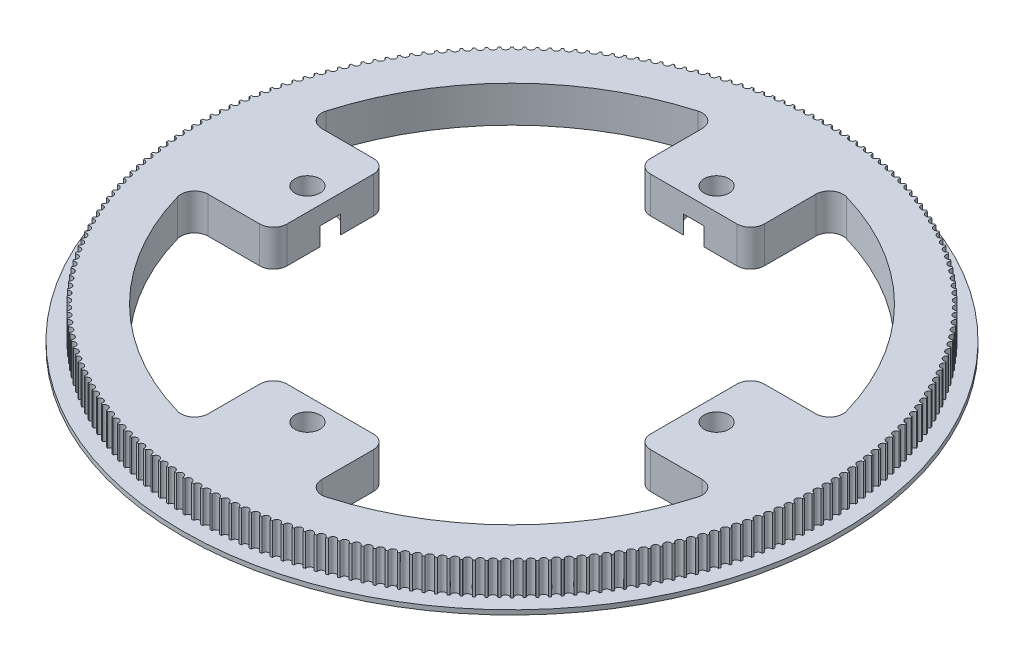
from build123d import *

# Parameters (mm, degrees)
BOSS_EXTRUDE1_DEPTH = 7
SKETCH3_R           = 72.5
BOSS_EXTRUDE3_DEPTH = 1
SKETCH13_R          = 2.75
CUT_EXTRUDE8_DEPTH  = 103.842111997
SKETCH14_R          = 40
CUT_EXTRUDE9_DEPTH  = 103.842111997
FILLET3_R           = 3
SKETCH15_R          = 5.5
CUT_EXTRUDE10_DEPTH = 4


with BuildPart() as part:
    # Sketch1 → Boss-Extrude1 (new body)
    with BuildSketch(Plane(origin=(0, 0, 0), x_dir=(1, 0, 0), z_dir=(0, 1, 0))):
        with BuildLine():
            ThreePointArc((-0.759988559, 69.250829904), (-0.988925477, 69.247938969), (-1.217851586, 69.244291191))
            ThreePointArc((-1.217851586, 69.244291191), (-1.955946699, 68.467067248), (-2.737208847, 69.200886647))
            ThreePointArc((-2.737208847, 69.200886647), (-2.965969848, 69.191459356), (-3.194698434, 69.18127584))
            ThreePointArc((-3.194698434, 69.18127584), (-3.9102981, 68.383291773), (-4.712196627, 69.094502154))
            ThreePointArc((-4.712196627, 69.094502154), (-4.940595132, 69.078546197), (-5.168939639, 69.061835249))
            ThreePointArc((-5.168939639, 69.061835249), (-5.861460206, 68.243741905), (-6.683341073, 68.931763195))
            ThreePointArc((-6.683341073, 68.931763195), (-6.911190796, 68.909291585), (-7.138964984, 68.886066835))
            ThreePointArc((-7.138964984, 68.886066835), (-7.80784162, 68.048531463), (-8.64903449, 68.7128025))
            ThreePointArc((-8.64903449, 68.7128025), (-8.876149594, 68.683833566), (-9.103167686, 68.654113956))
            ThreePointArc((-9.103167686, 68.654113956), (-9.747854848, 67.797819662), (-10.60767363, 68.437798658))
            ThreePointArc((-10.60767363, 68.437798658), (-10.833868876, 68.402356028), (-11.059945715, 68.366165797))
            ThreePointArc((-11.059945715, 68.366165797), (-11.679917584, 67.491810986), (-12.557660999, 68.106975966))
            ThreePointArc((-12.557660999, 68.106975966), (-12.7827519, 68.065088547), (-13.007703093, 68.022457213))
            ThreePointArc((-13.007703093, 68.022457213), (-13.602454013, 67.130755022), (-14.49740616, 67.720604247))
            ThreePointArc((-14.49740616, 67.720604247), (-14.721209128, 67.672306203), (-14.944851201, 67.623268537))
            ThreePointArc((-14.944851201, 67.623268537), (-15.513896085, 66.714946251), (-16.425327028, 67.278998633))
            ThreePointArc((-16.425327028, 67.278998633), (-16.647659527, 67.224329355), (-16.869810075, 67.168925353))
            ThreePointArc((-16.869810075, 67.168925353), (-17.412684801, 66.244723813), (-18.339851164, 66.782519302))
            ThreePointArc((-18.339851164, 66.782519302), (-18.560531855, 66.721523381), (-18.78100969, 66.65979823))
            ThreePointArc((-18.78100969, 66.65979823), (-19.297271481, 65.720471228), (-20.239417055, 66.23157119))
            ThreePointArc((-20.239417055, 66.23157119), (-20.458265948, 66.164298375), (-20.676891243, 66.096302419))
            ThreePointArc((-20.676891243, 66.096302419), (-21.16611903, 65.142616084), (-22.122475387, 65.626603659))
            ThreePointArc((-22.122475387, 65.626603659), (-22.339313986, 65.553108818), (-22.555908428, 65.478897517))
            ThreePointArc((-22.555908428, 65.478897517), (-23.017703188, 64.511629687), (-23.98749031, 64.968110128))
            ThreePointArc((-23.98749031, 64.968110128), (-24.202141758, 64.888453205), (-24.41652869, 64.808087086))
            ThreePointArc((-24.41652869, 64.808087086), (-24.850513778, 63.828026681), (-25.832940692, 64.256627675))
            ThreePointArc((-25.832940692, 64.256627675), (-26.045229917, 64.170873639), (-26.257234481, 64.08441825))
            ThreePointArc((-26.257234481, 64.08441825), (-26.663055932, 63.09236462), (-27.657321357, 63.492736595))
            ThreePointArc((-27.657321357, 63.492736595), (-27.867075212, 63.400955388), (-28.076524495, 63.308481243))
            ThreePointArc((-28.076524495, 63.308481243), (-28.453851316, 62.305243522), (-29.459144315, 62.677059928))
            ThreePointArc((-29.459144315, 62.677059928), (-29.666191722, 62.579326408), (-29.872914893, 62.48090893))
            ThreePointArc((-29.872914893, 62.48090893), (-30.22143933, 61.467305373), (-31.236939971, 61.810262952))
            ThreePointArc((-31.236939971, 61.810262952), (-31.441112059, 61.706656833), (-31.644940513, 61.602376293))
            ThreePointArc((-31.644940513, 61.602376293), (-31.964378304, 60.579233609), (-32.989258331, 60.893052639))
            ThreePointArc((-32.989258331, 60.893052639), (-33.190388575, 60.783658422), (-33.391156066, 60.673599873))
            ThreePointArc((-33.391156066, 60.673599873), (-33.681246674, 59.641752552), (-34.71467018, 59.926177079))
            ThreePointArc((-34.71467018, 59.926177079), (-34.912594534, 59.811083989), (-35.110137313, 59.695337195))
            ThreePointArc((-35.110137313, 59.695337195), (-35.370644135, 58.655626827), (-36.411768245, 58.910424869))
            ThreePointArc((-36.411768245, 58.910424869), (-36.60632528, 58.789726777), (-36.800482228, 58.668386144))
            ThreePointArc((-36.800482228, 58.668386144), (-37.031192792, 57.621660731), (-38.079168349, 57.846624472))
            ThreePointArc((-38.079168349, 57.846624472), (-38.270199382, 57.72041982), (-38.460812142, 57.593584316))
            ThreePointArc((-38.460812142, 57.593584316), (-38.661538276, 56.540697582), (-39.715510538, 56.735643538))
            ThreePointArc((-39.715510538, 56.735643538), (-39.902859761, 56.604035262), (-40.089772867, 56.471808334))
            ThreePointArc((-40.089772867, 56.471808334), (-40.260350856, 55.41361903), (-41.319460187, 55.5783882))
            ThreePointArc((-41.319460187, 55.5783882), (-41.502974794, 55.44148364), (-41.686035797, 55.303973135))
            ThreePointArc((-41.686035797, 55.303973135), (-41.826326516, 54.241344334), (-42.889709091, 54.375802331))
            ThreePointArc((-42.889709091, 54.375802331), (-43.069239406, 54.233713149), (-43.248298998, 54.091031223))
            ThreePointArc((-43.248298998, 54.091031223), (-43.358188024, 53.024829621), (-44.424976533, 53.128866777))
            ThreePointArc((-44.424976533, 53.128866777), (-44.600376129, 52.981708864), (-44.775288267, 52.833971889))
            ThreePointArc((-44.775288267, 52.833971889), (-44.854685972, 51.765067095), (-45.924010327, 51.838598558))
            ThreePointArc((-45.924010327, 51.838598558), (-46.095136145, 51.686491937), (-46.265758168, 51.533820411))
            ThreePointArc((-46.265758168, 51.533820411), (-46.314599794, 50.463084239), (-47.38558784, 50.506050034))
            ThreePointArc((-47.38558784, 50.506050034), (-47.552300307, 50.349118766), (-47.718493053, 50.191637209))
            ThreePointArc((-47.718493053, 50.191637209), (-47.736738765, 49.119942967), (-48.808516988, 49.132308051))
            ThreePointArc((-48.808516988, 49.132308051), (-48.970680131, 48.970680131), (-49.132308051, 48.808516988))
            ThreePointArc((-49.132308051, 48.808516988), (-49.119942967, 47.736738765), (-50.191637209, 47.718493053))
            ThreePointArc((-50.191637209, 47.718493053), (-50.349118766, 47.552300307), (-50.506050034, 47.38558784))
            ThreePointArc((-50.506050034, 47.38558784), (-50.463084239, 46.314599794), (-51.533820411, 46.265758168))
            ThreePointArc((-51.533820411, 46.265758168), (-51.686491937, 46.095136145), (-51.838598558, 45.924010327))
            ThreePointArc((-51.838598558, 45.924010327), (-51.765067095, 44.854685972), (-52.833971889, 44.775288267))
            ThreePointArc((-52.833971889, 44.775288267), (-52.981708864, 44.600376129), (-53.128866777, 44.424976533))
            ThreePointArc((-53.128866777, 44.424976533), (-53.024829621, 43.358188024), (-54.091031223, 43.248298998))
            ThreePointArc((-54.091031223, 43.248298998), (-54.233713149, 43.069239406), (-54.375802331, 42.889709091))
            ThreePointArc((-54.375802331, 42.889709091), (-54.241344334, 41.826326516), (-55.303973135, 41.686035797))
            ThreePointArc((-55.303973135, 41.686035797), (-55.44148364, 41.502974794), (-55.5783882, 41.319460187))
            ThreePointArc((-55.5783882, 41.319460187), (-55.41361903, 40.260350856), (-56.471808334, 40.089772867))
            ThreePointArc((-56.471808334, 40.089772867), (-56.604035262, 39.902859761), (-56.735643538, 39.715510538))
            ThreePointArc((-56.735643538, 39.715510538), (-56.540697582, 38.661538276), (-57.593584316, 38.460812142))
            ThreePointArc((-57.593584316, 38.460812142), (-57.72041982, 38.270199382), (-57.846624472, 38.079168349))
            ThreePointArc((-57.846624472, 38.079168349), (-57.621660731, 37.031192792), (-58.668386144, 36.800482228))
            ThreePointArc((-58.668386144, 36.800482228), (-58.789726777, 36.60632528), (-58.910424869, 36.411768245))
            ThreePointArc((-58.910424869, 36.411768245), (-58.655626827, 35.370644135), (-59.695337195, 35.110137313))
            ThreePointArc((-59.695337195, 35.110137313), (-59.811083989, 34.912594534), (-59.926177079, 34.71467018))
            ThreePointArc((-59.926177079, 34.71467018), (-59.641752552, 33.681246674), (-60.673599873, 33.391156066))
            ThreePointArc((-60.673599873, 33.391156066), (-60.783658422, 33.190388575), (-60.893052639, 32.989258331))
            ThreePointArc((-60.893052639, 32.989258331), (-60.579233609, 31.964378304), (-61.602376293, 31.644940513))
            ThreePointArc((-61.602376293, 31.644940513), (-61.706656833, 31.441112059), (-61.810262952, 31.236939971))
            ThreePointArc((-61.810262952, 31.236939971), (-61.467305373, 30.22143933), (-62.48090893, 29.872914893))
            ThreePointArc((-62.48090893, 29.872914893), (-62.579326408, 29.666191722), (-62.677059928, 29.459144315))
            ThreePointArc((-62.677059928, 29.459144315), (-62.305243522, 28.453851316), (-63.308481243, 28.076524495))
            ThreePointArc((-63.308481243, 28.076524495), (-63.400955388, 27.867075212), (-63.492736595, 27.657321357))
            ThreePointArc((-63.492736595, 27.657321357), (-63.09236462, 26.663055932), (-64.08441825, 26.257234481))
            ThreePointArc((-64.08441825, 26.257234481), (-64.170873639, 26.045229917), (-64.256627675, 25.832940692))
            ThreePointArc((-64.256627675, 25.832940692), (-63.828026681, 24.850513778), (-64.808087086, 24.41652869))
            ThreePointArc((-64.808087086, 24.41652869), (-64.888453205, 24.202141758), (-64.968110128, 23.98749031))
            ThreePointArc((-64.968110128, 23.98749031), (-64.511629687, 23.017703188), (-65.478897517, 22.555908428))
            ThreePointArc((-65.478897517, 22.555908428), (-65.553108818, 22.339313986), (-65.626603659, 22.122475387))
            ThreePointArc((-65.626603659, 22.122475387), (-65.142616084, 21.16611903), (-66.096302419, 20.676891243))
            ThreePointArc((-66.096302419, 20.676891243), (-66.164298375, 20.458265948), (-66.23157119, 20.239417055))
            ThreePointArc((-66.23157119, 20.239417055), (-65.720471228, 19.297271481), (-66.65979823, 18.78100969))
            ThreePointArc((-66.65979823, 18.78100969), (-66.721523381, 18.560531855), (-66.782519302, 18.339851164))
            ThreePointArc((-66.782519302, 18.339851164), (-66.244723813, 17.412684801), (-67.168925353, 16.869810075))
            ThreePointArc((-67.168925353, 16.869810075), (-67.224329355, 16.647659527), (-67.278998633, 16.425327028))
            ThreePointArc((-67.278998633, 16.425327028), (-66.714946251, 15.513896085), (-67.623268537, 14.944851201))
            ThreePointArc((-67.623268537, 14.944851201), (-67.672306203, 14.721209128), (-67.720604247, 14.49740616))
            ThreePointArc((-67.720604247, 14.49740616), (-67.130755022, 13.602454013), (-68.022457213, 13.007703093))
            ThreePointArc((-68.022457213, 13.007703093), (-68.065088547, 12.7827519), (-68.106975966, 12.557660999))
            ThreePointArc((-68.106975966, 12.557660999), (-67.491810986, 11.679917584), (-68.366165797, 11.059945715))
            ThreePointArc((-68.366165797, 11.059945715), (-68.402356028, 10.833868876), (-68.437798658, 10.60767363))
            ThreePointArc((-68.437798658, 10.60767363), (-67.797819662, 9.747854848), (-68.654113956, 9.103167686))
            ThreePointArc((-68.654113956, 9.103167686), (-68.683833566, 8.876149594), (-68.7128025, 8.64903449))
            ThreePointArc((-68.7128025, 8.64903449), (-68.048531463, 7.80784162), (-68.886066835, 7.138964984))
            ThreePointArc((-68.886066835, 7.138964984), (-68.909291585, 6.911190796), (-68.931763195, 6.683341073))
            ThreePointArc((-68.931763195, 6.683341073), (-68.243741905, 5.861460206), (-69.061835249, 5.168939639))
            ThreePointArc((-69.061835249, 5.168939639), (-69.078546197, 4.940595132), (-69.094502154, 4.712196627))
            ThreePointArc((-69.094502154, 4.712196627), (-68.383291773, 3.9102981), (-69.18127584, 3.194698434))
            ThreePointArc((-69.18127584, 3.194698434), (-69.191459356, 2.965969848), (-69.200886647, 2.737208847))
            ThreePointArc((-69.200886647, 2.737208847), (-68.467067248, 1.955946699), (-69.244291191, 1.217851586))
            ThreePointArc((-69.244291191, 1.217851586), (-69.247938969, 0.988925477), (-69.250829904, 0.759988559))
            ThreePointArc((-69.250829904, 0.759988559), (-68.495, 0), (-69.250829904, -0.759988559))
            ThreePointArc((-69.250829904, -0.759988559), (-69.247938969, -0.988925477), (-69.244291191, -1.217851586))
            ThreePointArc((-69.244291191, -1.217851586), (-68.467067248, -1.955946699), (-69.200886647, -2.737208847))
            ThreePointArc((-69.200886647, -2.737208847), (-69.191459356, -2.965969848), (-69.18127584, -3.194698434))
            ThreePointArc((-69.18127584, -3.194698434), (-68.383291773, -3.9102981), (-69.094502154, -4.712196627))
            ThreePointArc((-69.094502154, -4.712196627), (-69.078546197, -4.940595132), (-69.061835249, -5.168939639))
            ThreePointArc((-69.061835249, -5.168939639), (-68.243741905, -5.861460206), (-68.931763195, -6.683341073))
            ThreePointArc((-68.931763195, -6.683341073), (-68.909291585, -6.911190796), (-68.886066835, -7.138964984))
            ThreePointArc((-68.886066835, -7.138964984), (-68.048531463, -7.80784162), (-68.7128025, -8.64903449))
            ThreePointArc((-68.7128025, -8.64903449), (-68.683833566, -8.876149594), (-68.654113956, -9.103167686))
            ThreePointArc((-68.654113956, -9.103167686), (-67.797819662, -9.747854848), (-68.437798658, -10.60767363))
            ThreePointArc((-68.437798658, -10.60767363), (-68.402356028, -10.833868876), (-68.366165797, -11.059945715))
            ThreePointArc((-68.366165797, -11.059945715), (-67.491810986, -11.679917584), (-68.106975966, -12.557660999))
            ThreePointArc((-68.106975966, -12.557660999), (-68.065088547, -12.7827519), (-68.022457213, -13.007703093))
            ThreePointArc((-68.022457213, -13.007703093), (-67.130755022, -13.602454013), (-67.720604247, -14.49740616))
            ThreePointArc((-67.720604247, -14.49740616), (-67.672306203, -14.721209128), (-67.623268537, -14.944851201))
            ThreePointArc((-67.623268537, -14.944851201), (-66.714946251, -15.513896085), (-67.278998633, -16.425327028))
            ThreePointArc((-67.278998633, -16.425327028), (-67.224329355, -16.647659527), (-67.168925353, -16.869810075))
            ThreePointArc((-67.168925353, -16.869810075), (-66.244723813, -17.412684801), (-66.782519302, -18.339851164))
            ThreePointArc((-66.782519302, -18.339851164), (-66.721523381, -18.560531855), (-66.65979823, -18.78100969))
            ThreePointArc((-66.65979823, -18.78100969), (-65.720471228, -19.297271481), (-66.23157119, -20.239417055))
            ThreePointArc((-66.23157119, -20.239417055), (-66.164298375, -20.458265948), (-66.096302419, -20.676891243))
            ThreePointArc((-66.096302419, -20.676891243), (-65.142616084, -21.16611903), (-65.626603659, -22.122475387))
            ThreePointArc((-65.626603659, -22.122475387), (-65.553108818, -22.339313986), (-65.478897517, -22.555908428))
            ThreePointArc((-65.478897517, -22.555908428), (-64.511629687, -23.017703188), (-64.968110128, -23.98749031))
            ThreePointArc((-64.968110128, -23.98749031), (-64.888453205, -24.202141758), (-64.808087086, -24.41652869))
            ThreePointArc((-64.808087086, -24.41652869), (-63.828026681, -24.850513778), (-64.256627675, -25.832940692))
            ThreePointArc((-64.256627675, -25.832940692), (-64.170873639, -26.045229917), (-64.08441825, -26.257234481))
            ThreePointArc((-64.08441825, -26.257234481), (-63.09236462, -26.663055932), (-63.492736595, -27.657321357))
            ThreePointArc((-63.492736595, -27.657321357), (-63.400955388, -27.867075212), (-63.308481243, -28.076524495))
            ThreePointArc((-63.308481243, -28.076524495), (-62.305243522, -28.453851316), (-62.677059928, -29.459144315))
            ThreePointArc((-62.677059928, -29.459144315), (-62.579326408, -29.666191722), (-62.48090893, -29.872914893))
            ThreePointArc((-62.48090893, -29.872914893), (-61.467305373, -30.22143933), (-61.810262952, -31.236939971))
            ThreePointArc((-61.810262952, -31.236939971), (-61.706656833, -31.441112059), (-61.602376293, -31.644940513))
            ThreePointArc((-61.602376293, -31.644940513), (-60.579233609, -31.964378304), (-60.893052639, -32.989258331))
            ThreePointArc((-60.893052639, -32.989258331), (-60.783658422, -33.190388575), (-60.673599873, -33.391156066))
            ThreePointArc((-60.673599873, -33.391156066), (-59.641752552, -33.681246674), (-59.926177079, -34.71467018))
            ThreePointArc((-59.926177079, -34.71467018), (-59.811083989, -34.912594534), (-59.695337195, -35.110137313))
            ThreePointArc((-59.695337195, -35.110137313), (-58.655626827, -35.370644135), (-58.910424869, -36.411768245))
            ThreePointArc((-58.910424869, -36.411768245), (-58.789726777, -36.60632528), (-58.668386144, -36.800482228))
            ThreePointArc((-58.668386144, -36.800482228), (-57.621660731, -37.031192792), (-57.846624472, -38.079168349))
            ThreePointArc((-57.846624472, -38.079168349), (-57.72041982, -38.270199382), (-57.593584316, -38.460812142))
            ThreePointArc((-57.593584316, -38.460812142), (-56.540697582, -38.661538276), (-56.735643538, -39.715510538))
            ThreePointArc((-56.735643538, -39.715510538), (-56.604035262, -39.902859761), (-56.471808334, -40.089772867))
            ThreePointArc((-56.471808334, -40.089772867), (-55.41361903, -40.260350856), (-55.5783882, -41.319460187))
            ThreePointArc((-55.5783882, -41.319460187), (-55.44148364, -41.502974794), (-55.303973135, -41.686035797))
            ThreePointArc((-55.303973135, -41.686035797), (-54.241344334, -41.826326516), (-54.375802331, -42.889709091))
            ThreePointArc((-54.375802331, -42.889709091), (-54.233713149, -43.069239406), (-54.091031223, -43.248298998))
            ThreePointArc((-54.091031223, -43.248298998), (-53.024829621, -43.358188024), (-53.128866777, -44.424976533))
            ThreePointArc((-53.128866777, -44.424976533), (-52.981708864, -44.600376129), (-52.833971889, -44.775288267))
            ThreePointArc((-52.833971889, -44.775288267), (-51.765067095, -44.854685972), (-51.838598558, -45.924010327))
            ThreePointArc((-51.838598558, -45.924010327), (-51.686491937, -46.095136145), (-51.533820411, -46.265758168))
            ThreePointArc((-51.533820411, -46.265758168), (-50.463084239, -46.314599794), (-50.506050034, -47.38558784))
            ThreePointArc((-50.506050034, -47.38558784), (-50.349118766, -47.552300307), (-50.191637209, -47.718493053))
            ThreePointArc((-50.191637209, -47.718493053), (-49.119942967, -47.736738765), (-49.132308051, -48.808516988))
            ThreePointArc((-49.132308051, -48.808516988), (-48.970680131, -48.970680131), (-48.808516988, -49.132308051))
            ThreePointArc((-48.808516988, -49.132308051), (-47.736738765, -49.119942967), (-47.718493053, -50.191637209))
            ThreePointArc((-47.718493053, -50.191637209), (-47.552300307, -50.349118766), (-47.38558784, -50.506050034))
            ThreePointArc((-47.38558784, -50.506050034), (-46.314599794, -50.463084239), (-46.265758168, -51.533820411))
            ThreePointArc((-46.265758168, -51.533820411), (-46.095136145, -51.686491937), (-45.924010327, -51.838598558))
            ThreePointArc((-45.924010327, -51.838598558), (-44.854685972, -51.765067095), (-44.775288267, -52.833971889))
            ThreePointArc((-44.775288267, -52.833971889), (-44.600376129, -52.981708864), (-44.424976533, -53.128866777))
            ThreePointArc((-44.424976533, -53.128866777), (-43.358188024, -53.024829621), (-43.248298998, -54.091031223))
            ThreePointArc((-43.248298998, -54.091031223), (-43.069239406, -54.233713149), (-42.889709091, -54.375802331))
            ThreePointArc((-42.889709091, -54.375802331), (-41.826326516, -54.241344334), (-41.686035797, -55.303973135))
            ThreePointArc((-41.686035797, -55.303973135), (-41.502974794, -55.44148364), (-41.319460187, -55.5783882))
            ThreePointArc((-41.319460187, -55.5783882), (-40.260350856, -55.41361903), (-40.089772867, -56.471808334))
            ThreePointArc((-40.089772867, -56.471808334), (-39.902859761, -56.604035262), (-39.715510538, -56.735643538))
            ThreePointArc((-39.715510538, -56.735643538), (-38.661538276, -56.540697582), (-38.460812142, -57.593584316))
            ThreePointArc((-38.460812142, -57.593584316), (-38.270199382, -57.72041982), (-38.079168349, -57.846624472))
            ThreePointArc((-38.079168349, -57.846624472), (-37.031192792, -57.621660731), (-36.800482228, -58.668386144))
            ThreePointArc((-36.800482228, -58.668386144), (-36.60632528, -58.789726777), (-36.411768245, -58.910424869))
            ThreePointArc((-36.411768245, -58.910424869), (-35.370644135, -58.655626827), (-35.110137313, -59.695337195))
            ThreePointArc((-35.110137313, -59.695337195), (-34.912594534, -59.811083989), (-34.71467018, -59.926177079))
            ThreePointArc((-34.71467018, -59.926177079), (-33.681246674, -59.641752552), (-33.391156066, -60.673599873))
            ThreePointArc((-33.391156066, -60.673599873), (-33.190388575, -60.783658422), (-32.989258331, -60.893052639))
            ThreePointArc((-32.989258331, -60.893052639), (-31.964378304, -60.579233609), (-31.644940513, -61.602376293))
            ThreePointArc((-31.644940513, -61.602376293), (-31.441112059, -61.706656833), (-31.236939971, -61.810262952))
            ThreePointArc((-31.236939971, -61.810262952), (-30.22143933, -61.467305373), (-29.872914893, -62.48090893))
            ThreePointArc((-29.872914893, -62.48090893), (-29.666191722, -62.579326408), (-29.459144315, -62.677059928))
            ThreePointArc((-29.459144315, -62.677059928), (-28.453851316, -62.305243522), (-28.076524495, -63.308481243))
            ThreePointArc((-28.076524495, -63.308481243), (-27.867075212, -63.400955388), (-27.657321357, -63.492736595))
            ThreePointArc((-27.657321357, -63.492736595), (-26.663055932, -63.09236462), (-26.257234481, -64.08441825))
            ThreePointArc((-26.257234481, -64.08441825), (-26.045229917, -64.170873639), (-25.832940692, -64.256627675))
            ThreePointArc((-25.832940692, -64.256627675), (-24.850513778, -63.828026681), (-24.41652869, -64.808087086))
            ThreePointArc((-24.41652869, -64.808087086), (-24.202141758, -64.888453205), (-23.98749031, -64.968110128))
            ThreePointArc((-23.98749031, -64.968110128), (-23.017703188, -64.511629687), (-22.555908428, -65.478897517))
            ThreePointArc((-22.555908428, -65.478897517), (-22.339313986, -65.553108818), (-22.122475387, -65.626603659))
            ThreePointArc((-22.122475387, -65.626603659), (-21.16611903, -65.142616084), (-20.676891243, -66.096302419))
            ThreePointArc((-20.676891243, -66.096302419), (-20.458265948, -66.164298375), (-20.239417055, -66.23157119))
            ThreePointArc((-20.239417055, -66.23157119), (-19.297271481, -65.720471228), (-18.78100969, -66.65979823))
            ThreePointArc((-18.78100969, -66.65979823), (-18.560531855, -66.721523381), (-18.339851164, -66.782519302))
            ThreePointArc((-18.339851164, -66.782519302), (-17.412684801, -66.244723813), (-16.869810075, -67.168925353))
            ThreePointArc((-16.869810075, -67.168925353), (-16.647659527, -67.224329355), (-16.425327028, -67.278998633))
            ThreePointArc((-16.425327028, -67.278998633), (-15.513896085, -66.714946251), (-14.944851201, -67.623268537))
            ThreePointArc((-14.944851201, -67.623268537), (-14.721209128, -67.672306203), (-14.49740616, -67.720604247))
            ThreePointArc((-14.49740616, -67.720604247), (-13.602454013, -67.130755022), (-13.007703093, -68.022457213))
            ThreePointArc((-13.007703093, -68.022457213), (-12.7827519, -68.065088547), (-12.557660999, -68.106975966))
            ThreePointArc((-12.557660999, -68.106975966), (-11.679917584, -67.491810986), (-11.059945715, -68.366165797))
            ThreePointArc((-11.059945715, -68.366165797), (-10.833868876, -68.402356028), (-10.60767363, -68.437798658))
            ThreePointArc((-10.60767363, -68.437798658), (-9.747854848, -67.797819662), (-9.103167686, -68.654113956))
            ThreePointArc((-9.103167686, -68.654113956), (-8.876149594, -68.683833566), (-8.64903449, -68.7128025))
            ThreePointArc((-8.64903449, -68.7128025), (-7.80784162, -68.048531463), (-7.138964984, -68.886066835))
            ThreePointArc((-7.138964984, -68.886066835), (-6.911190796, -68.909291585), (-6.683341073, -68.931763195))
            ThreePointArc((-6.683341073, -68.931763195), (-5.861460206, -68.243741905), (-5.168939639, -69.061835249))
            ThreePointArc((-5.168939639, -69.061835249), (-4.940595132, -69.078546197), (-4.712196627, -69.094502154))
            ThreePointArc((-4.712196627, -69.094502154), (-3.9102981, -68.383291773), (-3.194698434, -69.18127584))
            ThreePointArc((-3.194698434, -69.18127584), (-2.965969848, -69.191459356), (-2.737208847, -69.200886647))
            ThreePointArc((-2.737208847, -69.200886647), (-1.955946699, -68.467067248), (-1.217851586, -69.244291191))
            ThreePointArc((-1.217851586, -69.244291191), (-0.988925477, -69.247938969), (-0.759988559, -69.250829904))
            ThreePointArc((-0.759988559, -69.250829904), (0, -68.495), (0.759988559, -69.250829904))
            ThreePointArc((0.759988559, -69.250829904), (0.988925477, -69.247938969), (1.217851586, -69.244291191))
            ThreePointArc((1.217851586, -69.244291191), (1.955946699, -68.467067248), (2.737208847, -69.200886647))
            ThreePointArc((2.737208847, -69.200886647), (2.965969848, -69.191459356), (3.194698434, -69.18127584))
            ThreePointArc((3.194698434, -69.18127584), (3.9102981, -68.383291773), (4.712196627, -69.094502154))
            ThreePointArc((4.712196627, -69.094502154), (4.940595132, -69.078546197), (5.168939639, -69.061835249))
            ThreePointArc((5.168939639, -69.061835249), (5.861460206, -68.243741905), (6.683341073, -68.931763195))
            ThreePointArc((6.683341073, -68.931763195), (6.911190796, -68.909291585), (7.138964984, -68.886066835))
            ThreePointArc((7.138964984, -68.886066835), (7.80784162, -68.048531463), (8.64903449, -68.7128025))
            ThreePointArc((8.64903449, -68.7128025), (8.876149594, -68.683833566), (9.103167686, -68.654113956))
            ThreePointArc((9.103167686, -68.654113956), (9.747854848, -67.797819662), (10.60767363, -68.437798658))
            ThreePointArc((10.60767363, -68.437798658), (10.833868876, -68.402356028), (11.059945715, -68.366165797))
            ThreePointArc((11.059945715, -68.366165797), (11.679917584, -67.491810986), (12.557660999, -68.106975966))
            ThreePointArc((12.557660999, -68.106975966), (12.7827519, -68.065088547), (13.007703093, -68.022457213))
            ThreePointArc((13.007703093, -68.022457213), (13.602454013, -67.130755022), (14.49740616, -67.720604247))
            ThreePointArc((14.49740616, -67.720604247), (14.721209128, -67.672306203), (14.944851201, -67.623268537))
            ThreePointArc((14.944851201, -67.623268537), (15.513896085, -66.714946251), (16.425327028, -67.278998633))
            ThreePointArc((16.425327028, -67.278998633), (16.647659527, -67.224329355), (16.869810075, -67.168925353))
            ThreePointArc((16.869810075, -67.168925353), (17.412684801, -66.244723813), (18.339851164, -66.782519302))
            ThreePointArc((18.339851164, -66.782519302), (18.560531855, -66.721523381), (18.78100969, -66.65979823))
            ThreePointArc((18.78100969, -66.65979823), (19.297271481, -65.720471228), (20.239417055, -66.23157119))
            ThreePointArc((20.239417055, -66.23157119), (20.458265948, -66.164298375), (20.676891243, -66.096302419))
            ThreePointArc((20.676891243, -66.096302419), (21.16611903, -65.142616084), (22.122475387, -65.626603659))
            ThreePointArc((22.122475387, -65.626603659), (22.339313986, -65.553108818), (22.555908428, -65.478897517))
            ThreePointArc((22.555908428, -65.478897517), (23.017703188, -64.511629687), (23.98749031, -64.968110128))
            ThreePointArc((23.98749031, -64.968110128), (24.202141758, -64.888453205), (24.41652869, -64.808087086))
            ThreePointArc((24.41652869, -64.808087086), (24.850513778, -63.828026681), (25.832940692, -64.256627675))
            ThreePointArc((25.832940692, -64.256627675), (26.045229917, -64.170873639), (26.257234481, -64.08441825))
            ThreePointArc((26.257234481, -64.08441825), (26.663055932, -63.09236462), (27.657321357, -63.492736595))
            ThreePointArc((27.657321357, -63.492736595), (27.867075212, -63.400955388), (28.076524495, -63.308481243))
            ThreePointArc((28.076524495, -63.308481243), (28.453851316, -62.305243522), (29.459144315, -62.677059928))
            ThreePointArc((29.459144315, -62.677059928), (29.666191722, -62.579326408), (29.872914893, -62.48090893))
            ThreePointArc((29.872914893, -62.48090893), (30.22143933, -61.467305373), (31.236939971, -61.810262952))
            ThreePointArc((31.236939971, -61.810262952), (31.441112059, -61.706656833), (31.644940513, -61.602376293))
            ThreePointArc((31.644940513, -61.602376293), (31.964378304, -60.579233609), (32.989258331, -60.893052639))
            ThreePointArc((32.989258331, -60.893052639), (33.190388575, -60.783658422), (33.391156066, -60.673599873))
            ThreePointArc((33.391156066, -60.673599873), (33.681246674, -59.641752552), (34.71467018, -59.926177079))
            ThreePointArc((34.71467018, -59.926177079), (34.912594534, -59.811083989), (35.110137313, -59.695337195))
            ThreePointArc((35.110137313, -59.695337195), (35.370644135, -58.655626827), (36.411768245, -58.910424869))
            ThreePointArc((36.411768245, -58.910424869), (36.60632528, -58.789726777), (36.800482228, -58.668386144))
            ThreePointArc((36.800482228, -58.668386144), (37.031192792, -57.621660731), (38.079168349, -57.846624472))
            ThreePointArc((38.079168349, -57.846624472), (38.270199382, -57.72041982), (38.460812142, -57.593584316))
            ThreePointArc((38.460812142, -57.593584316), (38.661538276, -56.540697582), (39.715510538, -56.735643538))
            ThreePointArc((39.715510538, -56.735643538), (39.902859761, -56.604035262), (40.089772867, -56.471808334))
            ThreePointArc((40.089772867, -56.471808334), (40.260350856, -55.41361903), (41.319460187, -55.5783882))
            ThreePointArc((41.319460187, -55.5783882), (41.502974794, -55.44148364), (41.686035797, -55.303973135))
            ThreePointArc((41.686035797, -55.303973135), (41.826326516, -54.241344334), (42.889709091, -54.375802331))
            ThreePointArc((42.889709091, -54.375802331), (43.069239406, -54.233713149), (43.248298998, -54.091031223))
            ThreePointArc((43.248298998, -54.091031223), (43.358188024, -53.024829621), (44.424976533, -53.128866777))
            ThreePointArc((44.424976533, -53.128866777), (44.600376129, -52.981708864), (44.775288267, -52.833971889))
            ThreePointArc((44.775288267, -52.833971889), (44.854685972, -51.765067095), (45.924010327, -51.838598558))
            ThreePointArc((45.924010327, -51.838598558), (46.095136145, -51.686491937), (46.265758168, -51.533820411))
            ThreePointArc((46.265758168, -51.533820411), (46.314599794, -50.463084239), (47.38558784, -50.506050034))
            ThreePointArc((47.38558784, -50.506050034), (47.552300307, -50.349118766), (47.718493053, -50.191637209))
            ThreePointArc((47.718493053, -50.191637209), (47.736738765, -49.119942967), (48.808516988, -49.132308051))
            ThreePointArc((48.808516988, -49.132308051), (48.970680131, -48.970680131), (49.132308051, -48.808516988))
            ThreePointArc((49.132308051, -48.808516988), (49.119942967, -47.736738765), (50.191637209, -47.718493053))
            ThreePointArc((50.191637209, -47.718493053), (50.349118766, -47.552300307), (50.506050034, -47.38558784))
            ThreePointArc((50.506050034, -47.38558784), (50.463084239, -46.314599794), (51.533820411, -46.265758168))
            ThreePointArc((51.533820411, -46.265758168), (51.686491937, -46.095136145), (51.838598558, -45.924010327))
            ThreePointArc((51.838598558, -45.924010327), (51.765067095, -44.854685972), (52.833971889, -44.775288267))
            ThreePointArc((52.833971889, -44.775288267), (52.981708864, -44.600376129), (53.128866777, -44.424976533))
            ThreePointArc((53.128866777, -44.424976533), (53.024829621, -43.358188024), (54.091031223, -43.248298998))
            ThreePointArc((54.091031223, -43.248298998), (54.233713149, -43.069239406), (54.375802331, -42.889709091))
            ThreePointArc((54.375802331, -42.889709091), (54.241344334, -41.826326516), (55.303973135, -41.686035797))
            ThreePointArc((55.303973135, -41.686035797), (55.44148364, -41.502974794), (55.5783882, -41.319460187))
            ThreePointArc((55.5783882, -41.319460187), (55.41361903, -40.260350856), (56.471808334, -40.089772867))
            ThreePointArc((56.471808334, -40.089772867), (56.604035262, -39.902859761), (56.735643538, -39.715510538))
            ThreePointArc((56.735643538, -39.715510538), (56.540697582, -38.661538276), (57.593584316, -38.460812142))
            ThreePointArc((57.593584316, -38.460812142), (57.72041982, -38.270199382), (57.846624472, -38.079168349))
            ThreePointArc((57.846624472, -38.079168349), (57.621660731, -37.031192792), (58.668386144, -36.800482228))
            ThreePointArc((58.668386144, -36.800482228), (58.789726777, -36.60632528), (58.910424869, -36.411768245))
            ThreePointArc((58.910424869, -36.411768245), (58.655626827, -35.370644135), (59.695337195, -35.110137313))
            ThreePointArc((59.695337195, -35.110137313), (59.811083989, -34.912594534), (59.926177079, -34.71467018))
            ThreePointArc((59.926177079, -34.71467018), (59.641752552, -33.681246674), (60.673599873, -33.391156066))
            ThreePointArc((60.673599873, -33.391156066), (60.783658422, -33.190388575), (60.893052639, -32.989258331))
            ThreePointArc((60.893052639, -32.989258331), (60.579233609, -31.964378304), (61.602376293, -31.644940513))
            ThreePointArc((61.602376293, -31.644940513), (61.706656833, -31.441112059), (61.810262952, -31.236939971))
            ThreePointArc((61.810262952, -31.236939971), (61.467305373, -30.22143933), (62.48090893, -29.872914893))
            ThreePointArc((62.48090893, -29.872914893), (62.579326408, -29.666191722), (62.677059928, -29.459144315))
            ThreePointArc((62.677059928, -29.459144315), (62.305243522, -28.453851316), (63.308481243, -28.076524495))
            ThreePointArc((63.308481243, -28.076524495), (63.400955388, -27.867075212), (63.492736595, -27.657321357))
            ThreePointArc((63.492736595, -27.657321357), (63.09236462, -26.663055932), (64.08441825, -26.257234481))
            ThreePointArc((64.08441825, -26.257234481), (64.170873639, -26.045229917), (64.256627675, -25.832940692))
            ThreePointArc((64.256627675, -25.832940692), (63.828026681, -24.850513778), (64.808087086, -24.41652869))
            ThreePointArc((64.808087086, -24.41652869), (64.888453205, -24.202141758), (64.968110128, -23.98749031))
            ThreePointArc((64.968110128, -23.98749031), (64.511629687, -23.017703188), (65.478897517, -22.555908428))
            ThreePointArc((65.478897517, -22.555908428), (65.553108818, -22.339313986), (65.626603659, -22.122475387))
            ThreePointArc((65.626603659, -22.122475387), (65.142616084, -21.16611903), (66.096302419, -20.676891243))
            ThreePointArc((66.096302419, -20.676891243), (66.164298375, -20.458265948), (66.23157119, -20.239417055))
            ThreePointArc((66.23157119, -20.239417055), (65.720471228, -19.297271481), (66.65979823, -18.78100969))
            ThreePointArc((66.65979823, -18.78100969), (66.721523381, -18.560531855), (66.782519302, -18.339851164))
            ThreePointArc((66.782519302, -18.339851164), (66.244723813, -17.412684801), (67.168925353, -16.869810075))
            ThreePointArc((67.168925353, -16.869810075), (67.224329355, -16.647659527), (67.278998633, -16.425327028))
            ThreePointArc((67.278998633, -16.425327028), (66.714946251, -15.513896085), (67.623268537, -14.944851201))
            ThreePointArc((67.623268537, -14.944851201), (67.672306203, -14.721209128), (67.720604247, -14.49740616))
            ThreePointArc((67.720604247, -14.49740616), (67.130755022, -13.602454013), (68.022457213, -13.007703093))
            ThreePointArc((68.022457213, -13.007703093), (68.065088547, -12.7827519), (68.106975966, -12.557660999))
            ThreePointArc((68.106975966, -12.557660999), (67.491810986, -11.679917584), (68.366165797, -11.059945715))
            ThreePointArc((68.366165797, -11.059945715), (68.402356028, -10.833868876), (68.437798658, -10.60767363))
            ThreePointArc((68.437798658, -10.60767363), (67.797819662, -9.747854848), (68.654113956, -9.103167686))
            ThreePointArc((68.654113956, -9.103167686), (68.683833566, -8.876149594), (68.7128025, -8.64903449))
            ThreePointArc((68.7128025, -8.64903449), (68.048531463, -7.80784162), (68.886066835, -7.138964984))
            ThreePointArc((68.886066835, -7.138964984), (68.909291585, -6.911190796), (68.931763195, -6.683341073))
            ThreePointArc((68.931763195, -6.683341073), (68.243741905, -5.861460206), (69.061835249, -5.168939639))
            ThreePointArc((69.061835249, -5.168939639), (69.078546197, -4.940595132), (69.094502154, -4.712196627))
            ThreePointArc((69.094502154, -4.712196627), (68.383291773, -3.9102981), (69.18127584, -3.194698434))
            ThreePointArc((69.18127584, -3.194698434), (69.191459356, -2.965969848), (69.200886647, -2.737208847))
            ThreePointArc((69.200886647, -2.737208847), (68.467067248, -1.955946699), (69.244291191, -1.217851586))
            ThreePointArc((69.244291191, -1.217851586), (69.247938969, -0.988925477), (69.250829904, -0.759988559))
            ThreePointArc((69.250829904, -0.759988559), (68.495, 0), (69.250829904, 0.759988559))
            ThreePointArc((69.250829904, 0.759988559), (69.247938969, 0.988925477), (69.244291191, 1.217851586))
            ThreePointArc((69.244291191, 1.217851586), (68.467067248, 1.955946699), (69.200886647, 2.737208847))
            ThreePointArc((69.200886647, 2.737208847), (69.191459356, 2.965969848), (69.18127584, 3.194698434))
            ThreePointArc((69.18127584, 3.194698434), (68.383291773, 3.9102981), (69.094502154, 4.712196627))
            ThreePointArc((69.094502154, 4.712196627), (69.078546197, 4.940595132), (69.061835249, 5.168939639))
            ThreePointArc((69.061835249, 5.168939639), (68.243741905, 5.861460206), (68.931763195, 6.683341073))
            ThreePointArc((68.931763195, 6.683341073), (68.909291585, 6.911190796), (68.886066835, 7.138964984))
            ThreePointArc((68.886066835, 7.138964984), (68.048531463, 7.80784162), (68.7128025, 8.64903449))
            ThreePointArc((68.7128025, 8.64903449), (68.683833566, 8.876149594), (68.654113956, 9.103167686))
            ThreePointArc((68.654113956, 9.103167686), (67.797819662, 9.747854848), (68.437798658, 10.60767363))
            ThreePointArc((68.437798658, 10.60767363), (68.402356028, 10.833868876), (68.366165797, 11.059945715))
            ThreePointArc((68.366165797, 11.059945715), (67.491810986, 11.679917584), (68.106975966, 12.557660999))
            ThreePointArc((68.106975966, 12.557660999), (68.065088547, 12.7827519), (68.022457213, 13.007703093))
            ThreePointArc((68.022457213, 13.007703093), (67.130755022, 13.602454013), (67.720604247, 14.49740616))
            ThreePointArc((67.720604247, 14.49740616), (67.672306203, 14.721209128), (67.623268537, 14.944851201))
            ThreePointArc((67.623268537, 14.944851201), (66.714946251, 15.513896085), (67.278998633, 16.425327028))
            ThreePointArc((67.278998633, 16.425327028), (67.224329355, 16.647659527), (67.168925353, 16.869810075))
            ThreePointArc((67.168925353, 16.869810075), (66.244723813, 17.412684801), (66.782519302, 18.339851164))
            ThreePointArc((66.782519302, 18.339851164), (66.721523381, 18.560531855), (66.65979823, 18.78100969))
            ThreePointArc((66.65979823, 18.78100969), (65.720471228, 19.297271481), (66.23157119, 20.239417055))
            ThreePointArc((66.23157119, 20.239417055), (66.164298375, 20.458265948), (66.096302419, 20.676891243))
            ThreePointArc((66.096302419, 20.676891243), (65.142616084, 21.16611903), (65.626603659, 22.122475387))
            ThreePointArc((65.626603659, 22.122475387), (65.553108818, 22.339313986), (65.478897517, 22.555908428))
            ThreePointArc((65.478897517, 22.555908428), (64.511629687, 23.017703188), (64.968110128, 23.98749031))
            ThreePointArc((64.968110128, 23.98749031), (64.888453205, 24.202141758), (64.808087086, 24.41652869))
            ThreePointArc((64.808087086, 24.41652869), (63.828026681, 24.850513778), (64.256627675, 25.832940692))
            ThreePointArc((64.256627675, 25.832940692), (64.170873639, 26.045229917), (64.08441825, 26.257234481))
            ThreePointArc((64.08441825, 26.257234481), (63.09236462, 26.663055932), (63.492736595, 27.657321357))
            ThreePointArc((63.492736595, 27.657321357), (63.400955388, 27.867075212), (63.308481243, 28.076524495))
            ThreePointArc((63.308481243, 28.076524495), (62.305243522, 28.453851316), (62.677059928, 29.459144315))
            ThreePointArc((62.677059928, 29.459144315), (62.579326408, 29.666191722), (62.48090893, 29.872914893))
            ThreePointArc((62.48090893, 29.872914893), (61.467305373, 30.22143933), (61.810262952, 31.236939971))
            ThreePointArc((61.810262952, 31.236939971), (61.706656833, 31.441112059), (61.602376293, 31.644940513))
            ThreePointArc((61.602376293, 31.644940513), (60.579233609, 31.964378304), (60.893052639, 32.989258331))
            ThreePointArc((60.893052639, 32.989258331), (60.783658422, 33.190388575), (60.673599873, 33.391156066))
            ThreePointArc((60.673599873, 33.391156066), (59.641752552, 33.681246674), (59.926177079, 34.71467018))
            ThreePointArc((59.926177079, 34.71467018), (59.811083989, 34.912594534), (59.695337195, 35.110137313))
            ThreePointArc((59.695337195, 35.110137313), (58.655626827, 35.370644135), (58.910424869, 36.411768245))
            ThreePointArc((58.910424869, 36.411768245), (58.789726777, 36.60632528), (58.668386144, 36.800482228))
            ThreePointArc((58.668386144, 36.800482228), (57.621660731, 37.031192792), (57.846624472, 38.079168349))
            ThreePointArc((57.846624472, 38.079168349), (57.72041982, 38.270199382), (57.593584316, 38.460812142))
            ThreePointArc((57.593584316, 38.460812142), (56.540697582, 38.661538276), (56.735643538, 39.715510538))
            ThreePointArc((56.735643538, 39.715510538), (56.604035262, 39.902859761), (56.471808334, 40.089772867))
            ThreePointArc((56.471808334, 40.089772867), (55.41361903, 40.260350856), (55.5783882, 41.319460187))
            ThreePointArc((55.5783882, 41.319460187), (55.44148364, 41.502974794), (55.303973135, 41.686035797))
            ThreePointArc((55.303973135, 41.686035797), (54.241344334, 41.826326516), (54.375802331, 42.889709091))
            ThreePointArc((54.375802331, 42.889709091), (54.233713149, 43.069239406), (54.091031223, 43.248298998))
            ThreePointArc((54.091031223, 43.248298998), (53.024829621, 43.358188024), (53.128866777, 44.424976533))
            ThreePointArc((53.128866777, 44.424976533), (52.981708864, 44.600376129), (52.833971889, 44.775288267))
            ThreePointArc((52.833971889, 44.775288267), (51.765067095, 44.854685972), (51.838598558, 45.924010327))
            ThreePointArc((51.838598558, 45.924010327), (51.686491937, 46.095136145), (51.533820411, 46.265758168))
            ThreePointArc((51.533820411, 46.265758168), (50.463084239, 46.314599794), (50.506050034, 47.38558784))
            ThreePointArc((50.506050034, 47.38558784), (50.349118766, 47.552300307), (50.191637209, 47.718493053))
            ThreePointArc((50.191637209, 47.718493053), (49.119942967, 47.736738765), (49.132308051, 48.808516988))
            ThreePointArc((49.132308051, 48.808516988), (48.970680131, 48.970680131), (48.808516988, 49.132308051))
            ThreePointArc((48.808516988, 49.132308051), (47.736738765, 49.119942967), (47.718493053, 50.191637209))
            ThreePointArc((47.718493053, 50.191637209), (47.552300307, 50.349118766), (47.38558784, 50.506050034))
            ThreePointArc((47.38558784, 50.506050034), (46.314599794, 50.463084239), (46.265758168, 51.533820411))
            ThreePointArc((46.265758168, 51.533820411), (46.095136145, 51.686491937), (45.924010327, 51.838598558))
            ThreePointArc((45.924010327, 51.838598558), (44.854685972, 51.765067095), (44.775288267, 52.833971889))
            ThreePointArc((44.775288267, 52.833971889), (44.600376129, 52.981708864), (44.424976533, 53.128866777))
            ThreePointArc((44.424976533, 53.128866777), (43.358188024, 53.024829621), (43.248298998, 54.091031223))
            ThreePointArc((43.248298998, 54.091031223), (43.069239406, 54.233713149), (42.889709091, 54.375802331))
            ThreePointArc((42.889709091, 54.375802331), (41.826326516, 54.241344334), (41.686035797, 55.303973135))
            ThreePointArc((41.686035797, 55.303973135), (41.502974794, 55.44148364), (41.319460187, 55.5783882))
            ThreePointArc((41.319460187, 55.5783882), (40.260350856, 55.41361903), (40.089772867, 56.471808334))
            ThreePointArc((40.089772867, 56.471808334), (39.902859761, 56.604035262), (39.715510538, 56.735643538))
            ThreePointArc((39.715510538, 56.735643538), (38.661538276, 56.540697582), (38.460812142, 57.593584316))
            ThreePointArc((38.460812142, 57.593584316), (38.270199382, 57.72041982), (38.079168349, 57.846624472))
            ThreePointArc((38.079168349, 57.846624472), (37.031192792, 57.621660731), (36.800482228, 58.668386144))
            ThreePointArc((36.800482228, 58.668386144), (36.60632528, 58.789726777), (36.411768245, 58.910424869))
            ThreePointArc((36.411768245, 58.910424869), (35.370644135, 58.655626827), (35.110137313, 59.695337195))
            ThreePointArc((35.110137313, 59.695337195), (34.912594534, 59.811083989), (34.71467018, 59.926177079))
            ThreePointArc((34.71467018, 59.926177079), (33.681246674, 59.641752552), (33.391156066, 60.673599873))
            ThreePointArc((33.391156066, 60.673599873), (33.190388575, 60.783658422), (32.989258331, 60.893052639))
            ThreePointArc((32.989258331, 60.893052639), (31.964378304, 60.579233609), (31.644940513, 61.602376293))
            ThreePointArc((31.644940513, 61.602376293), (31.441112059, 61.706656833), (31.236939971, 61.810262952))
            ThreePointArc((31.236939971, 61.810262952), (30.22143933, 61.467305373), (29.872914893, 62.48090893))
            ThreePointArc((29.872914893, 62.48090893), (29.666191722, 62.579326408), (29.459144315, 62.677059928))
            ThreePointArc((29.459144315, 62.677059928), (28.453851316, 62.305243522), (28.076524495, 63.308481243))
            ThreePointArc((28.076524495, 63.308481243), (27.867075212, 63.400955388), (27.657321357, 63.492736595))
            ThreePointArc((27.657321357, 63.492736595), (26.663055932, 63.09236462), (26.257234481, 64.08441825))
            ThreePointArc((26.257234481, 64.08441825), (26.045229917, 64.170873639), (25.832940692, 64.256627675))
            ThreePointArc((25.832940692, 64.256627675), (24.850513778, 63.828026681), (24.41652869, 64.808087086))
            ThreePointArc((24.41652869, 64.808087086), (24.202141758, 64.888453205), (23.98749031, 64.968110128))
            ThreePointArc((23.98749031, 64.968110128), (23.017703188, 64.511629687), (22.555908428, 65.478897517))
            ThreePointArc((22.555908428, 65.478897517), (22.339313986, 65.553108818), (22.122475387, 65.626603659))
            ThreePointArc((22.122475387, 65.626603659), (21.16611903, 65.142616084), (20.676891243, 66.096302419))
            ThreePointArc((20.676891243, 66.096302419), (20.458265948, 66.164298375), (20.239417055, 66.23157119))
            ThreePointArc((20.239417055, 66.23157119), (19.297271481, 65.720471228), (18.78100969, 66.65979823))
            ThreePointArc((18.78100969, 66.65979823), (18.560531855, 66.721523381), (18.339851164, 66.782519302))
            ThreePointArc((18.339851164, 66.782519302), (17.412684801, 66.244723813), (16.869810075, 67.168925353))
            ThreePointArc((16.869810075, 67.168925353), (16.647659527, 67.224329355), (16.425327028, 67.278998633))
            ThreePointArc((16.425327028, 67.278998633), (15.513896085, 66.714946251), (14.944851201, 67.623268537))
            ThreePointArc((14.944851201, 67.623268537), (14.721209128, 67.672306203), (14.49740616, 67.720604247))
            ThreePointArc((14.49740616, 67.720604247), (13.602454013, 67.130755022), (13.007703093, 68.022457213))
            ThreePointArc((13.007703093, 68.022457213), (12.7827519, 68.065088547), (12.557660999, 68.106975966))
            ThreePointArc((12.557660999, 68.106975966), (11.679917584, 67.491810986), (11.059945715, 68.366165797))
            ThreePointArc((11.059945715, 68.366165797), (10.833868876, 68.402356028), (10.60767363, 68.437798658))
            ThreePointArc((10.60767363, 68.437798658), (9.747854848, 67.797819662), (9.103167686, 68.654113956))
            ThreePointArc((9.103167686, 68.654113956), (8.876149594, 68.683833566), (8.64903449, 68.7128025))
            ThreePointArc((8.64903449, 68.7128025), (7.80784162, 68.048531463), (7.138964984, 68.886066835))
            ThreePointArc((7.138964984, 68.886066835), (6.911190796, 68.909291585), (6.683341073, 68.931763195))
            ThreePointArc((6.683341073, 68.931763195), (5.861460206, 68.243741905), (5.168939639, 69.061835249))
            ThreePointArc((5.168939639, 69.061835249), (4.940595132, 69.078546197), (4.712196627, 69.094502154))
            ThreePointArc((4.712196627, 69.094502154), (3.9102981, 68.383291773), (3.194698434, 69.18127584))
            ThreePointArc((3.194698434, 69.18127584), (2.965969848, 69.191459356), (2.737208847, 69.200886647))
            ThreePointArc((2.737208847, 69.200886647), (1.955946699, 68.467067248), (1.217851586, 69.244291191))
            ThreePointArc((1.217851586, 69.244291191), (0.988925477, 69.247938969), (0.759988559, 69.250829904))
            ThreePointArc((0.759988559, 69.250829904), (0, 68.495), (-0.759988559, 69.250829904))
        make_face()
    extrude(amount=BOSS_EXTRUDE1_DEPTH)

    # Sketch3 → Boss-Extrude3 (add)
    with BuildSketch(Plane.XZ):
        with Locations(Location((0, 0, 0), (0, 0, 270))):
            Circle(SKETCH3_R)
    extrude(amount=BOSS_EXTRUDE3_DEPTH)

    # Sketch13 → Cut-Extrude8 (cut, through all)
    with BuildSketch(Plane.XZ.offset(1)):
        with Locations(Location((-45, 0, 0), (0, 0, 270))):
            Circle(SKETCH13_R)
        with Locations(Location((0, 45, 0), (0, 0, 270))):
            Circle(SKETCH13_R)
        with Locations(Location((45, 0, 0), (0, 0, 270))):
            Circle(SKETCH13_R)
        with Locations(Location((0, -45, 0), (0, 0, 270))):
            Circle(SKETCH13_R)
    extrude(amount=-CUT_EXTRUDE8_DEPTH, mode=Mode.SUBTRACT)

    # Sketch14 → Cut-Extrude9 (cut, through all)
    with BuildSketch(Plane.XZ.offset(1)):
        with BuildLine():
            ThreePointArc((-58.172158289, -12.5), (-42.072853481, -42.072853481), (-12.5, -58.172158289))
            Line((-12.5, -58.172158289), (-12.5, -40))
            Line((-12.5, -40), (2e-08, -40))
            ThreePointArc((2e-08, -40), (-28.28427124, -28.284271255), (-40, 0))
            Line((-40, 0), (-40, -12.5))
            Line((-40, -12.5), (-58.172158289, -12.5))
        make_face()
        Circle(SKETCH14_R)
        with BuildLine():
            Line((-40, 12.5), (-40, 0))
            ThreePointArc((-40, 0), (-28.284271249, 28.284271246), (-5e-09, 40))
            Line((-5e-09, 40), (-12.5, 40))
            Line((-12.5, 40), (-12.5, 58.172158289))
            ThreePointArc((-12.5, 58.172158289), (-42.072853481, 42.072853481), (-58.172158289, 12.5))
            Line((-58.172158289, 12.5), (-40, 12.5))
        make_face()
        with BuildLine():
            ThreePointArc((-5e-09, 40), (28.284271246, 28.284271249), (40, 0))
            Line((40, 0), (40, 12.5))
            Line((40, 12.5), (58.172158289, 12.5))
            ThreePointArc((58.172158289, 12.5), (42.072853481, 42.072853481), (12.5, 58.172158289))
            Line((12.5, 58.172158289), (12.5, 40))
            Line((12.5, 40), (-5e-09, 40))
        make_face()
        with BuildLine():
            Line((12.5, -40), (12.5, -58.172158289))
            ThreePointArc((12.5, -58.172158289), (42.072853481, -42.072853481), (58.172158289, -12.5))
            Line((58.172158289, -12.5), (40, -12.5))
            Line((40, -12.5), (40, 0))
            ThreePointArc((40, 0), (28.284271255, -28.28427124), (2e-08, -40))
            Line((2e-08, -40), (12.5, -40))
        make_face()
    extrude(amount=-CUT_EXTRUDE9_DEPTH, mode=Mode.SUBTRACT)

    # Fillet3
    fillet3_edges = [part.edges().sort_by_distance(p)[0] for p in [
        (-58.172158289, 3, -12.5),
        (-40, 3, -12.5),
        (-40, 3, 12.5),
        (-58.172158289, 3, 12.5),
        (-12.5, 3, 58.172158289),
        (-12.5, 3, 40),
        (12.5, 3, 40),
        (12.5, 3, 58.172158289),
        (58.172158289, 3, 12.5),
        (40, 3, 12.5),
        (40, 3, -12.5),
        (58.172158289, 3, -12.5),
        (12.5, 3, -58.172158289),
        (12.5, 3, -40),
        (-12.5, 3, -40),
        (-12.5, 3, -58.172158289),
    ]]
    fillet(fillet3_edges, radius=FILLET3_R)

    # Sketch15 → Cut-Extrude10 (cut)
    with BuildSketch(Plane.XZ.offset(1)):
        with Locations((-45, 0)):
            Circle(SKETCH15_R)
        with Locations((0, 45)):
            Circle(SKETCH15_R)
        with Locations((45, 0)):
            Circle(SKETCH15_R)
        with Locations((0, -45)):
            Circle(SKETCH15_R)
    extrude(amount=-CUT_EXTRUDE10_DEPTH, mode=Mode.SUBTRACT)


solid = part.part
